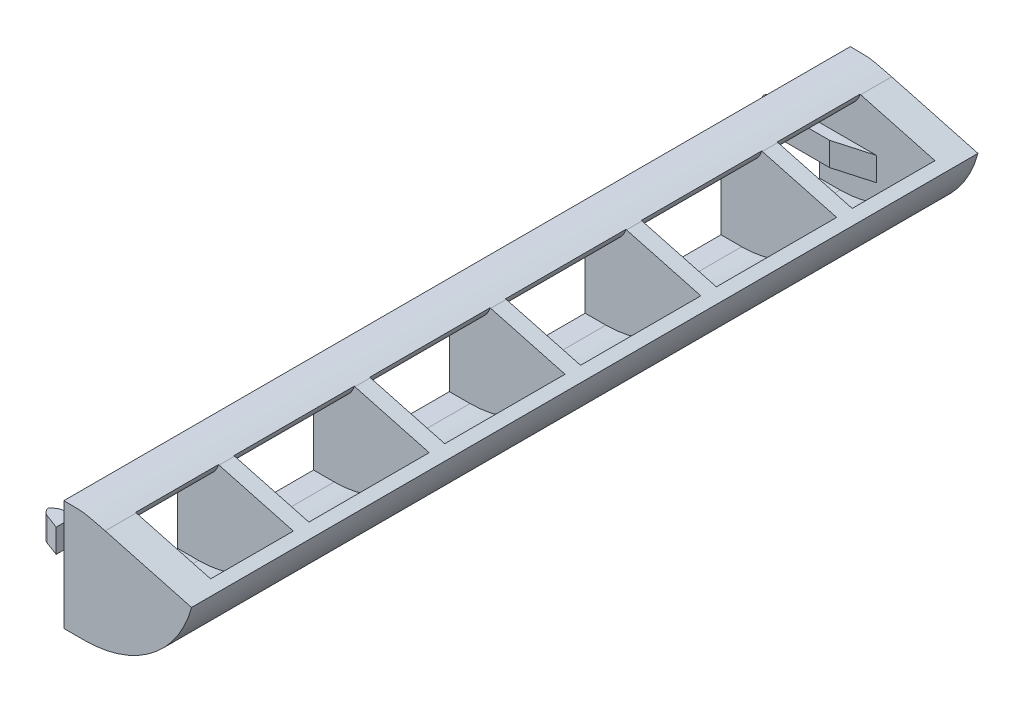
from build123d import *

# Parameters (mm, degrees)
SKETCH1_W             = 70
SKETCH1_H             = 7.5
SKETCH1_W_2           = 1.5
BOSS_EXTRUDE1_DEPTH   = 2
SWEEP1_START          = -73
SWEEP1_DEPTH          = 76
SWEEP1_2_DEPTH        = 3
SWEEP1_3_DEPTH        = 3
SWEEP1_START_2        = -62
SWEEP1_4_DEPTH        = 1.5
SWEEP1_START_3        = -48.875
SWEEP1_5_DEPTH        = 1.5
SWEEP1_START_4        = -35.75
SWEEP1_6_DEPTH        = 1.5
SWEEP1_START_5        = -22.625
SWEEP1_7_DEPTH        = 1.5
SWEEP1_START_6        = -9.5
SWEEP1_8_DEPTH        = 1.5
CUT_EXTRUDE1_DEPTH    = 80
SKETCH4_W             = 1
SKETCH4_H             = 2.284825157
BOSS_EXTRUDE2_DEPTH   = 5
BOSS_EXTRUDE2_2_DEPTH = 5
CUT_EXTRUDE2_DEPTH    = 5
BOSS_EXTRUDE3_DEPTH   = 2.284825157
BOSS_EXTRUDE4_DEPTH   = 2.284825157
FILLET1_R             = 1
FILLET2_R             = 0.2


# Read off the part's stored shape, not the designer's step: Sweep1
with BuildPart() as part:
    # Sketch1 → Boss-Extrude1 (new body)
    # profile 1 of 6: a face of its own
    with BuildSketch(Plane(origin=(0, 0, 0), x_dir=(0, 0, -1), z_dir=(1, 0, 0))):
        Polygon((73, 9.5), (73, 7.5), (73, 0), (73, -1.2), (70, -1.2), (-3, -1.2), (-3, 9.5), (70, 9.5), align=None)
        with Locations((35, 3.75)):
            Rectangle(SKETCH1_W, SKETCH1_H, mode=Mode.SUBTRACT)
    # profile 2 of 6: a face of its own
    with BuildSketch(Plane(origin=(0, 0, 0), x_dir=(0, 0, -1), z_dir=(1, 0, 0))):
        with Locations((8.75, 3.75)):
            Rectangle(SKETCH1_W_2, SKETCH1_H)
    # profile 3 of 6: a face of its own
    with BuildSketch(Plane(origin=(0, 0, 0), x_dir=(0, 0, -1), z_dir=(1, 0, 0))):
        with Locations((21.875, 3.75)):
            Rectangle(SKETCH1_W_2, SKETCH1_H)
    # profile 4 of 6: a face of its own
    with BuildSketch(Plane(origin=(0, 0, 0), x_dir=(0, 0, -1), z_dir=(1, 0, 0))):
        with Locations((35, 3.75)):
            Rectangle(SKETCH1_W_2, SKETCH1_H)
    # profile 5 of 6: a face of its own
    with BuildSketch(Plane(origin=(0, 0, 0), x_dir=(0, 0, -1), z_dir=(1, 0, 0))):
        with Locations((48.125, 3.75)):
            Rectangle(SKETCH1_W_2, SKETCH1_H)
    # profile 6 of 6: a face of its own
    with BuildSketch(Plane(origin=(0, 0, 0), x_dir=(0, 0, -1), z_dir=(1, 0, 0))):
        with Locations((61.25, 3.75)):
            Rectangle(SKETCH1_W_2, SKETCH1_H)
    extrude(amount=BOSS_EXTRUDE1_DEPTH)

    # Sweep1 outline → Sweep1 (add)
    with BuildSketch(Plane.XY.offset(SWEEP1_START)):
        with BuildLine():
            Line((2, 0), (2, -1.2))
            ThreePointArc((2, -1.2), (8.51374729, 1.011119259), (12.335406341, 6.730636217))
            Line((12.335406341, 6.730636217), (11.17629535, 7.041219072))
            ThreePointArc((11.17629535, 7.041219072), (7.783233576, 1.963143267), (2, 0))
        make_face()
        with BuildLine():
            Line((2, 9.5), (2, 7.5))
            ThreePointArc((2, 7.5), (3.217522858, 7.913293319), (3.931851653, 8.98236191))
            Line((3.931851653, 8.98236191), (2, 9.5))
        make_face()
    extrude(amount=SWEEP1_DEPTH)

    # Sweep1 2 outline → Sweep1 2 (add)
    with BuildSketch(Plane.XY.offset(SWEEP1_START)):
        with BuildLine():
            Line((2, 7.5), (2, 0))
            ThreePointArc((2, 0), (7.783233576, 1.963143267), (11.17629535, 7.041219072))
            Line((11.17629535, 7.041219072), (3.931851653, 8.98236191))
            ThreePointArc((3.931851653, 8.98236191), (3.217522858, 7.913293319), (2, 7.5))
        make_face()
    extrude(amount=SWEEP1_2_DEPTH)

    # Sweep1 3 outline → Sweep1 3 (add)
    with BuildSketch(Plane.XY):
        with BuildLine():
            Line((2, 7.5), (2, 0))
            ThreePointArc((2, 0), (7.783233576, 1.963143267), (11.17629535, 7.041219072))
            Line((11.17629535, 7.041219072), (3.931851653, 8.98236191))
            ThreePointArc((3.931851653, 8.98236191), (3.217522858, 7.913293319), (2, 7.5))
        make_face()
    extrude(amount=SWEEP1_3_DEPTH)

    # Sweep1 4 outline → Sweep1 4 (add)
    with BuildSketch(Plane.XY.offset(SWEEP1_START_2)):
        with BuildLine():
            Line((2, 7.5), (2, 0))
            ThreePointArc((2, 0), (7.783233576, 1.963143267), (11.17629535, 7.041219072))
            Line((11.17629535, 7.041219072), (3.931851653, 8.98236191))
            ThreePointArc((3.931851653, 8.98236191), (3.217522858, 7.913293319), (2, 7.5))
        make_face()
    extrude(amount=SWEEP1_4_DEPTH)

    # Sweep1 5 outline → Sweep1 5 (add)
    with BuildSketch(Plane.XY.offset(SWEEP1_START_3)):
        with BuildLine():
            Line((2, 7.5), (2, 0))
            ThreePointArc((2, 0), (7.783233576, 1.963143267), (11.17629535, 7.041219072))
            Line((11.17629535, 7.041219072), (3.931851653, 8.98236191))
            ThreePointArc((3.931851653, 8.98236191), (3.217522858, 7.913293319), (2, 7.5))
        make_face()
    extrude(amount=SWEEP1_5_DEPTH)

    # Sweep1 6 outline → Sweep1 6 (add)
    with BuildSketch(Plane.XY.offset(SWEEP1_START_4)):
        with BuildLine():
            Line((2, 7.5), (2, 0))
            ThreePointArc((2, 0), (7.783233576, 1.963143267), (11.17629535, 7.041219072))
            Line((11.17629535, 7.041219072), (3.931851653, 8.98236191))
            ThreePointArc((3.931851653, 8.98236191), (3.217522858, 7.913293319), (2, 7.5))
        make_face()
    extrude(amount=SWEEP1_6_DEPTH)

    # Sweep1 7 outline → Sweep1 7 (add)
    with BuildSketch(Plane.XY.offset(SWEEP1_START_5)):
        with BuildLine():
            Line((2, 7.5), (2, 0))
            ThreePointArc((2, 0), (7.783233576, 1.963143267), (11.17629535, 7.041219072))
            Line((11.17629535, 7.041219072), (3.931851653, 8.98236191))
            ThreePointArc((3.931851653, 8.98236191), (3.217522858, 7.913293319), (2, 7.5))
        make_face()
    extrude(amount=SWEEP1_7_DEPTH)

    # Sweep1 8 outline → Sweep1 8 (add)
    with BuildSketch(Plane.XY.offset(SWEEP1_START_6)):
        with BuildLine():
            Line((2, 7.5), (2, 0))
            ThreePointArc((2, 0), (7.783233576, 1.963143267), (11.17629535, 7.041219072))
            Line((11.17629535, 7.041219072), (3.931851653, 8.98236191))
            ThreePointArc((3.931851653, 8.98236191), (3.217522858, 7.913293319), (2, 7.5))
        make_face()
    extrude(amount=SWEEP1_8_DEPTH)

    # Sketch3 → Cut-Extrude1 (cut)
    with BuildSketch(Plane.XY.offset(3)):
        with BuildLine():
            add(Edge.make_bspline(
                [(0, 9.5), (1.85008807, 9.446594219), (1.503968772, 9.616267019), (3.992528633, 8.966103562)],
                knots=[0, 0, 0, 0, 1, 1, 1, 1], degree=3))
            Line((3.992528633, 8.966103562), (2, 9.5))
            Line((2, 9.5), (0, 9.5))
        make_face()
    extrude(amount=-CUT_EXTRUDE1_DEPTH, mode=Mode.SUBTRACT)



with BuildPart() as body_2:
    # Sketch4 → Boss-Extrude2 (new body)
    with BuildSketch(Plane.ZY):
        with Locations((-69.5, 3.512617973)):
            Rectangle(SKETCH4_W, SKETCH4_H)
    extrude(amount=BOSS_EXTRUDE2_DEPTH)


with BuildPart() as body_3:
    # Sketch4 → Boss-Extrude2 2 (new body)
    with BuildSketch(Plane.ZY):
        with Locations((-0.5, 3.512617973)):
            Rectangle(SKETCH4_W, SKETCH4_H)
    extrude(amount=BOSS_EXTRUDE2_2_DEPTH)


with BuildPart() as cut_extrude2_tool:
    # Sketch5 → Cut-Extrude2 (new body)
    with BuildSketch(Plane(origin=(0, 4.655030551, 0), x_dir=(1, 0, 0), z_dir=(0, 1, 0))):
        Polygon((-4.341933066, 69), (-5, 69.5), (-5, 69), align=None)
        Polygon((-5, 1), (-5, 0.5), (-4.341933066, 1), align=None)
    extrude(amount=-CUT_EXTRUDE2_DEPTH)


with BuildPart() as body_2_1:
    add(body_2.part)

    # Cut-Extrude2: cut by cut_extrude2_tool
    add(cut_extrude2_tool.part, mode=Mode.SUBTRACT)



with BuildPart() as body_3_1:
    add(body_3.part)

    # Cut-Extrude2: cut by cut_extrude2_tool
    add(cut_extrude2_tool.part, mode=Mode.SUBTRACT)


with BuildPart() as body_2_2:
    add(body_2_1.part)

    add(body_3_1.part)  # Boss-Extrude3 merges body 3
    # Sketch6 → Boss-Extrude3 (add)
    with BuildSketch(Plane(origin=(0, 4.655030551, 0), x_dir=(1, 0, 0), z_dir=(0, 1, 0))):
        Polygon((-3, 70.742293059), (-5, 70), (-3, 70), align=None)
        Polygon((-3, 0), (-5, 0), (-3, -0.742293059), align=None)
    extrude(amount=-BOSS_EXTRUDE3_DEPTH)


with BuildPart() as part_1:
    add(part.part)

    add(body_2_2.part)  # Boss-Extrude4 merges body 2
    # Sketch7 → Boss-Extrude4 (add)
    with BuildSketch(Plane(origin=(0, 4.655030551, 0), x_dir=(1, 0, 0), z_dir=(0, 1, 0))):
        Polygon((0, 69), (2, 69), (5.524751143, 70), (0, 70), align=None)
        Polygon((0, 0), (0, 1), (2, 1), (5.524751143, 0), align=None)
    extrude(amount=-BOSS_EXTRUDE4_DEPTH)

    # Fillet1
    # the kernel refuses this fillet: 1 mm, written as the material it takes off along each edge
    with BuildSketch(Plane(origin=(-4.341933066, 5.497044152, -69), x_dir=(1, 0, 0), z_dir=(0, -1, 0))) as fillet1_piece_1:
        with BuildLine():
            CenterArc((FILLET1_R * 0.336805440666, -FILLET1_R), FILLET1_R, 90, 37.22761065)
            Line((-FILLET1_R * 0.268177449166, -FILLET1_R * 0.203761528805), (-FILLET1_R * 0.280277106962, -FILLET1_R * 0.187836759381))
            Line((-FILLET1_R * 0.280277106962, -FILLET1_R * 0.187836759381), (-FILLET1_R * 0.00673610881331, FILLET1_R * 0.02))
            Line((-FILLET1_R * 0.00673610881331, FILLET1_R * 0.02), (FILLET1_R * 0.336805440666, FILLET1_R * 0.02))
            Line((FILLET1_R * 0.336805440666, FILLET1_R * 0.02), (FILLET1_R * 0.336805440666, 0))
        make_face()
    extrude(amount=3.96885236, mode=Mode.SUBTRACT)
    with BuildSketch(Plane(origin=(-5, 0.687101271, -70), x_dir=(0, 0, 1), z_dir=(0, 1, 0))) as fillet1_piece_2:
        with BuildLine():
            CenterArc((0.703254318, 0.979125979), FILLET1_R, 200.362233207, 57.910439257)
            Line((-0.234257231, 0.631171821), (-0.253007462, 0.624212738))
            Line((-0.253007462, 0.624212738), (-0.018750231, -0.006959083))
            Line((-0.018750231, -0.006959083), (0, -0.02))
            ThreePointArc((0, -0.02), (0.25, -0.02), (0.495934914, -0.01958252))
            Line((0.495934914, -0.01958252), (0.5, 0))
        make_face()
    extrude(amount=5.651033402, mode=Mode.SUBTRACT)
    with BuildSketch(Plane(origin=(-5, 0.687101271, 0), x_dir=(0, 0, -1), z_dir=(0, 1, 0))) as fillet1_piece_3:
        with BuildLine():
            CenterArc((0.703254318, -0.979125979), FILLET1_R, 101.727327536, 57.910439257)
            Line((-0.234257231, -0.631171821), (-0.253007462, -0.624212738))
            Line((-0.253007462, -0.624212738), (-0.018750231, 0.006959083))
            Line((-0.018750231, 0.006959083), (0, 0.02))
            ThreePointArc((0, 0.02), (0.25, 0.02), (0.495934914, 0.01958252))
            Line((0.495934914, 0.01958252), (0.5, 0))
        make_face()
    extrude(amount=5.651033402, mode=Mode.SUBTRACT)
    with BuildSketch(Plane(origin=(-4.341933066, 5.497044152, -1), x_dir=(1, 0, 0), z_dir=(0, -1, 0))) as fillet1_piece_4:
        with BuildLine():
            CenterArc((FILLET1_R * 0.336805440666, FILLET1_R), FILLET1_R, 232.77238935, 37.22761065)
            Line((-FILLET1_R * 0.268177449166, FILLET1_R * 0.203761528805), (-FILLET1_R * 0.280277106962, FILLET1_R * 0.187836759381))
            Line((-FILLET1_R * 0.280277106962, FILLET1_R * 0.187836759381), (-FILLET1_R * 0.00673610881331, -FILLET1_R * 0.02))
            Line((-FILLET1_R * 0.00673610881331, -FILLET1_R * 0.02), (FILLET1_R * 0.336805440666, -FILLET1_R * 0.02))
            Line((FILLET1_R * 0.336805440666, -FILLET1_R * 0.02), (FILLET1_R * 0.336805440666, 0))
        make_face()
    extrude(amount=3.96885236, mode=Mode.SUBTRACT)

    # Fillet2
    fillet2_edges = [part_1.edges().sort_by_distance(p)[0] for p in [
        (-5, 3.512617972, -69.5),
        (-5, 3.512617972, -0.5),
    ]]
    fillet(fillet2_edges, radius=FILLET2_R)


solid = part_1.part
